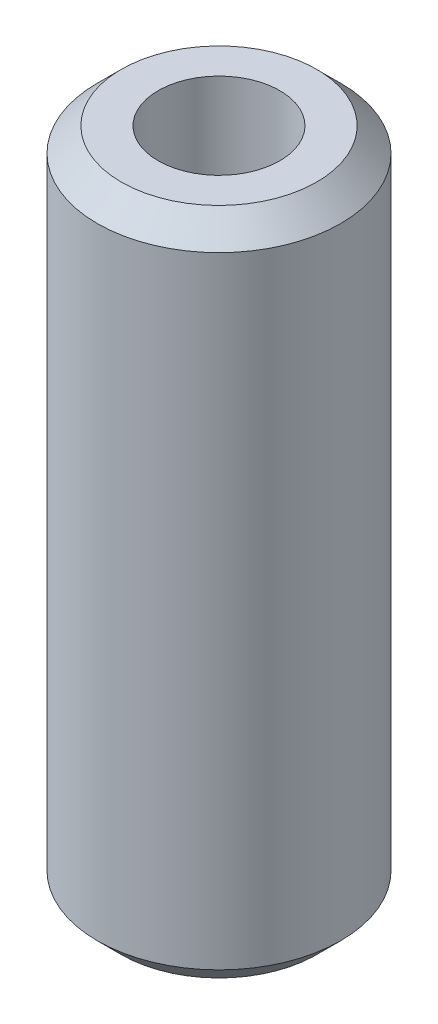
from build123d import *

# Parameters (mm, degrees)
SKETCH1_R           = 12.7
SKETCH1_R_2         = 6.35
BOSS_EXTRUDE1_DEPTH = 34.925
CHAMFER1_SIZE       = 2.5
SCALE1_SCALE        = 0.111317254


with BuildPart() as part:
    # Sketch1 → Boss-Extrude1 (new, symmetric)
    with BuildSketch(Plane(origin=(0, 0, 0), x_dir=(1, 0, 0), z_dir=(0, 1, 0))):
        Circle(SKETCH1_R)
        Circle(SKETCH1_R_2, mode=Mode.SUBTRACT)
    extrude(amount=BOSS_EXTRUDE1_DEPTH, both=True)

    # Chamfer1
    chamfer1_edges = [part.edges().sort_by_distance(p)[0] for p in [
        (-12.7, -34.925, 0),
        (-12.7, 34.925, 0),
    ]]
    chamfer(chamfer1_edges, length=CHAMFER1_SIZE)


with BuildPart() as part_1:
    # Scale1: scaled about (0, 0, 0)
    add(part.part.scale(SCALE1_SCALE))


solid = part_1.part
